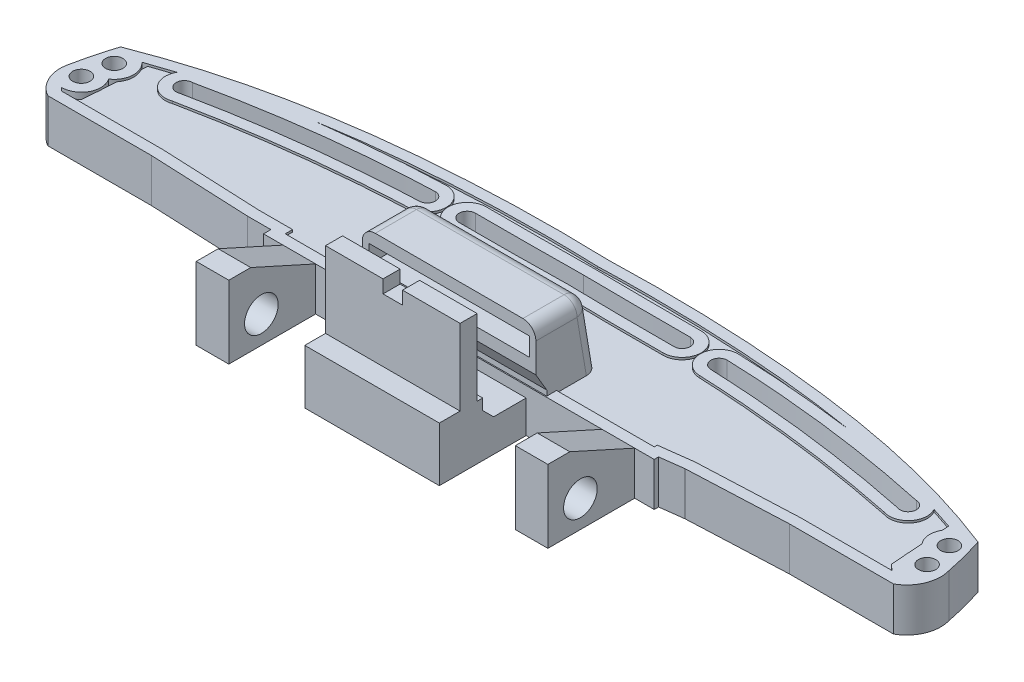
from build123d import *

# Parameters (mm, degrees)
SKETCH_1_R          = 0.8
EXTRUDE_1_DEPTH     = 4
SHELL_START         = 1
SHELL_1_DEPTH       = 3
EXTRUDE_2_DEPTH     = 3.8
EXTRUDE_3_DEPTH     = 6.7
CUT_EXTRUDE_1_REACH = 61.527
SKETCH_2_R          = 1.55
SKETCH_1_8_W        = 12.4
SKETCH_1_8_H        = 4
EXTRUDE_4_DEPTH     = 5
SKETCH_1_9_W        = 12.4
SKETCH_1_9_H        = 4
EXTRUDE_5_DEPTH     = 3
SKETCH_4_W          = 1.753819933
SKETCH_4_H          = 3
CUT_EXTRUDE_2_DEPTH = 8
EXTRUDE_6_DEPTH     = 8
CHAMFER_2_SIZE      = 1
SKETCH_1_11_R       = 0.8
EXTRUDE_7_DEPTH     = 4
FILLET_1_R          = 1
SKETCH_11_W         = 12.4
SKETCH_11_H         = 1.569277624
EXTRUDE_9_DEPTH     = 7
EXTRUDE_11_DEPTH    = 2
EXTRUDE_14_REACH    = 45.714
FILLET_2_R          = 1.2
SKETCH_15_W         = 14.8
SKETCH_15_H         = 1.7
EXTRUDE_15_DEPTH    = 1
EXTRUDE_16_DEPTH    = 16
SKETCH_18_W         = 1.797299214
SKETCH_18_H         = 2.4
CUT_EXTRUDE_3_DEPTH = 10


# Read off the part's stored shape, not the designer's step: 抽壳1
with BuildPart() as part:
    # 草图1 → 凸台-拉伸1 (new body)
    # profile 1 of 3: a face of its own
    with BuildSketch(Plane(origin=(0, 0, 0), x_dir=(1, 0, 0), z_dir=(0, 1, 0))):
        with BuildLine():
            Line((-38.96480314, -7.497712444), (-29.393525536, -7.497712444))
            Line((-29.393525536, -7.497712444), (-20.156837739, -7.907195239))
            Line((-20.156837739, -7.907195239), (-18, -7.907195239))
            Line((-18, -7.907195239), (-18, -8.583774419))
            Line((-18, -8.583774419), (-16.2, -8.583774419))
            Line((-16.2, -8.583774419), (-13.2, -8.583774419))
            Line((-13.2, -8.583774419), (-6.2, -8.583774419))
            Line((-6.2, -8.583774419), (6.2, -8.583774419))
            Line((6.2, -8.583774419), (13.2, -8.583774419))
            Line((13.2, -8.583774419), (16.2, -8.583774419))
            Line((16.2, -8.583774419), (18, -8.583774419))
            Line((18, -8.583774419), (18, -8.184966001))
            Line((18, -8.184966001), (20.156837739, -7.907195239))
            Line((20.156837739, -7.907195239), (29.393525536, -7.497712444))
            Line((29.393525536, -7.497712444), (38.96480314, -7.497712444))
            Line((38.96480314, -7.497712444), (37.300502483, -6.034961991))
            Line((37.300502483, -6.034961991), (36.881910732, -0.253586766))
            ThreePointArc((36.881910732, -0.253586766), (36.960080712, 0.200241061), (37.127970419, 0.629057209))
            add(Edge.make_bspline(
                [(37.127970419, 0.629057209), (30.270446567, 3.021780895), (17.796753113, 5.157311237), (5.274918027, 5.3743435), (0, 5.207531858)],
                knots=[0.063130869, 0.063130869, 0.063130869, 0.063130869, 0.605883571, 1, 1, 1, 1], degree=3))
            add(Edge.make_bspline(
                [(-37.127970419, 0.629057209), (-30.270446567, 3.021780895), (-17.796753113, 5.157311237), (-5.274918027, 5.3743435), (0, 5.207531858)],
                knots=[0.063130869, 0.063130869, 0.063130869, 0.063130869, 0.605883571, 1, 1, 1, 1], degree=3))
            ThreePointArc((-37.127970419, 0.629057209), (-36.960080712, 0.200241061), (-36.881910732, -0.253586766))
            Line((-36.881910732, -0.253586766), (-37.300502483, -6.034961991))
            Line((-37.300502483, -6.034961991), (-38.96480314, -7.497712444))
        make_face()
        with BuildLine():
            ThreePointArc((-33.061660008, -1.226254047), (-34.086546844, -0.682084578), (-33.351229287, 0.215591046))
            add(Edge.make_bspline(
                [(-33.351229287, 0.215591046), (-23.514023654, 2.352155328), (-13.434430896, 2.701648191)],
                knots=[0, 0, 0, 0.998944651, 0.998944651, 0.998944651], degree=2))
            ThreePointArc((-13.434430896, 2.701648191), (-12.694803379, 1.962371896), (-13.413133172, 1.20238465))
            add(Edge.make_bspline(
                [(-33.061660008, -1.226254047), (-23.344686362, 0.787158383), (-13.413133172, 1.20238465)],
                knots=[0, 0, 0, 1, 1, 1], degree=2))
        make_face(mode=Mode.SUBTRACT)
        with BuildLine():
            ThreePointArc((-9.887768141, 1.328554628), (-10.637768141, 2.078554628), (-9.887768141, 2.828554628))
            add(Edge.make_bspline(
                [(-9.887768141, 2.828554628), (-4.938004407, 2.816621436), (0.01152505, 2.875884827)],
                knots=[0, 0, 0, 1, 1, 1], degree=2))
            add(Edge.make_bspline(
                [(9.910818241, 2.828554628), (4.961054507, 2.816621436), (0.01152505, 2.875884827)],
                knots=[0, 0, 0, 1, 1, 1], degree=2))
            ThreePointArc((9.910818241, 2.828554628), (10.660818241, 2.078554628), (9.910818241, 1.328554628))
            add(Edge.make_bspline(
                [(9.910818241, 1.328554628), (4.96080606, 1.306493196), (0.01152505, 1.409786988)],
                knots=[0, 0, 0, 1, 1, 1], degree=2))
            add(Edge.make_bspline(
                [(-9.887768141, 1.328554628), (-4.93775596, 1.306493196), (0.01152505, 1.409786988)],
                knots=[0, 0, 0, 1, 1, 1], degree=2))
        make_face(mode=Mode.SUBTRACT)
        with BuildLine():
            add(Edge.make_bspline(
                [(33.061660008, -1.226254047), (23.344686362, 0.787158383), (13.413133172, 1.20238465)],
                knots=[0, 0, 0, 1, 1, 1], degree=2))
            ThreePointArc((13.413133172, 1.20238465), (12.694803379, 1.962371896), (13.434430896, 2.701648191))
            add(Edge.make_bspline(
                [(33.351229287, 0.215591046), (23.514023654, 2.352155328), (13.434430896, 2.701648191)],
                knots=[0, 0, 0, 0.998944651, 0.998944651, 0.998944651], degree=2))
            ThreePointArc((33.351229287, 0.215591046), (34.086546844, -0.682084578), (33.061660008, -1.226254047))
        make_face(mode=Mode.SUBTRACT)
    # profile 2 of 3: a face of its own
    with BuildSketch(Plane(origin=(0, 0, 0), x_dir=(1, 0, 0), z_dir=(0, 1, 0))):
        with BuildLine():
            ThreePointArc((-40.451237786, -3.867865455), (-40.341747598, -5.94230236), (-38.96480314, -7.497712444))
            Line((-38.96480314, -7.497712444), (-37.300502483, -6.034961991))
            Line((-37.300502483, -6.034961991), (-36.881910732, -0.253586766))
            ThreePointArc((-36.881910732, -0.253586766), (-36.960080712, 0.200241061), (-37.127970419, 0.629057209))
            add(Edge.make_bspline(
                [(-39.505366958, -0.253586766), (-38.718261239, 0.056798706), (-37.925610736, 0.350744961), (-37.127970419, 0.629057209)],
                knots=[0, 0, 0, 0, 0.063130869, 0.063130869, 0.063130869, 0.063130869], degree=3))
            ThreePointArc((-39.505366958, -0.253586766), (-40.028164459, -2.047677008), (-40.451237786, -3.867865455))
        make_face()
        with Locations(Location((-38.96480314, -4.404121314, 0), (0, 0, 270))):
            Circle(SKETCH_1_R, mode=Mode.SUBTRACT)
        with Locations(Location((-38.479248946, -1.862182302, 0), (0, 0, 270))):
            Circle(SKETCH_1_R, mode=Mode.SUBTRACT)
    # profile 3 of 3: a face of its own
    with BuildSketch(Plane(origin=(0, 0, 0), x_dir=(1, 0, 0), z_dir=(0, 1, 0))):
        with BuildLine():
            add(Edge.make_bspline(
                [(39.505366958, -0.253586766), (38.718261239, 0.056798706), (37.925610736, 0.350744961), (37.127970419, 0.629057209)],
                knots=[0, 0, 0, 0, 0.063130869, 0.063130869, 0.063130869, 0.063130869], degree=3))
            ThreePointArc((37.127970419, 0.629057209), (36.960080712, 0.200241061), (36.881910732, -0.253586766))
            Line((36.881910732, -0.253586766), (37.300502483, -6.034961991))
            Line((37.300502483, -6.034961991), (38.96480314, -7.497712444))
            ThreePointArc((38.96480314, -7.497712444), (40.341747598, -5.94230236), (40.451237786, -3.867865455))
            ThreePointArc((40.451237786, -3.867865455), (40.028164459, -2.047677008), (39.505366958, -0.253586766))
        make_face()
        with Locations(Location((38.96480314, -4.404121314, 0), (0, 0, 270))):
            Circle(SKETCH_1_R, mode=Mode.SUBTRACT)
        with Locations(Location((38.479248946, -1.862182302, 0), (0, 0, 270))):
            Circle(SKETCH_1_R, mode=Mode.SUBTRACT)
    extrude(amount=EXTRUDE_1_DEPTH)

    # 抽壳1 outline → 抽壳1 (cut)
    with BuildSketch(Plane(origin=(0, 0, 0), x_dir=(1, 0, 0), z_dir=(0, 1, 0)).offset(SHELL_START)):
        with BuildLine():
            add(Edge.make_bspline(
                [(-24.49070999, 2.779879065), (-24.059101821, 2.852450392), (-23.626992114, 2.922741536), (-23.194404558, 2.990785688), (-22.761362874, 3.056616067), (-22.327890816, 3.120265913), (-21.894012163, 3.181768496), (-21.459750721, 3.241157111), (-21.025130316, 3.298465077), (-20.590174791, 3.353725741), (-20.154908007, 3.406972473), (-19.49234821, 3.484957996), (-19.265264519, 3.511139327), (-19.038106147, 3.5367874), (-18.810876479, 3.561906949), (-18.5835789, 3.586502713), (-18.356216795, 3.610579427), (-18.128793551, 3.63414183), (-17.901312551, 3.657194657), (-17.673777182, 3.679742646), (-17.446190829, 3.701790533), (-16.990922924, 3.744895577), (-16.76323695, 3.765953394), (-16.535535964, 3.786516726), (-16.307709362, 3.806603903), (-16.079975464, 3.826198645), (-15.852126823, 3.845318548), (-15.624182283, 3.86397736), (-15.3963646, 3.88216395), (-15.168440109, 3.89988033), (-14.940524265, 3.917133229), (-14.256711016, 3.967500107), (-13.800762072, 3.999223967), (-13.344739701, 4.029109633), (-12.88864392, 4.057172967), (-12.432474744, 4.083429833), (-11.976232192, 4.107896096), (-11.519916278, 4.130587618), (-11.06352702, 4.151520264), (-10.607064435, 4.170709896), (-10.150528539, 4.188172379), (-9.237310159, 4.219674773), (-8.780627682, 4.233714674), (-8.323872017, 4.246059151), (-7.867043262, 4.256724074), (-7.410141515, 4.265725315), (-6.953166875, 4.273078745), (-6.49611944, 4.278800234), (-6.038999307, 4.282905654), (-5.581806577, 4.285410875), (-5.124541347, 4.286331769), (-4.438534898, 4.285360425), (-4.209847992, 4.284644532), (-3.981143016, 4.283538512), (-3.752419987, 4.282044352), (-3.523678926, 4.280164036), (-3.29491985, 4.277899551), (-3.066142779, 4.275252883), (-2.837347732, 4.272226016), (-2.608534727, 4.268820938), (-2.379703784, 4.265039633), (-2.036430489, 4.258806314), (-1.922001578, 4.256634981), (-1.807568191, 4.254370336), (-1.693130329, 4.252012628), (-1.578687996, 4.249562105), (-1.464241195, 4.247019016), (-1.349789928, 4.244383608), (-1.235334198, 4.241656131), (-1.120874008, 4.238836832), (-1.00640936, 4.23592596), (-0.834705706, 4.231422665), (-0.777470041, 4.229898735), (-0.720233262, 4.228352005), (-0.662995371, 4.226782507), (-0.605756367, 4.22519027), (-0.548516251, 4.223575326), (-0.491275022, 4.221937707), (-0.434032683, 4.220277442), (-0.376789232, 4.218594564), (-0.319544671, 4.216889103), (-0.247987581, 4.214729087), (-0.233676093, 4.214295675), (-0.219364536, 4.213860853), (-0.20505291, 4.213424623), (-0.190741215, 4.212986985), (-0.17642945, 4.212547939), (-0.162117615, 4.212107486), (-0.147805712, 4.211665627), (-0.133493739, 4.211222362), (-0.119181696, 4.210777691), (-0.101291556, 4.210220096), (-0.097713524, 4.210108489), (-0.094135488, 4.209996794), (-0.090557447, 4.209885012), (-0.086979401, 4.209773141), (-0.083401352, 4.209661183), (-0.079823298, 4.209549138), (-0.076245239, 4.209437004), (-0.072667177, 4.209324783), (-0.06908911, 4.209212473), (-0.063722003, 4.209043878), (-0.061932966, 4.208987658), (-0.060143928, 4.208931415), (-0.05835489, 4.208875151), (-0.05656585, 4.208818865), (-0.054776809, 4.208762557), (-0.052987766, 4.208706227), (-0.051198723, 4.208649875), (-0.049409679, 4.208593501), (-0.047620634, 4.208537105), (-0.044937064, 4.208452478), (-0.04404254, 4.208424264), (-0.043148017, 4.208396044), (-0.042253492, 4.208367819), (-0.041358968, 4.208339588), (-0.040464444, 4.208311352), (-0.039569919, 4.20828311), (-0.038675394, 4.208254863), (-0.037780868, 4.20822661), (-0.036886342, 4.208198352), (-0.035097291, 4.208141824), (-0.034196153, 4.208113347), (-0.033347957, 4.208086533), (-0.032301441, 4.20805345), (-0.031697693, 4.208034384), (-0.030471916, 4.207995538), (-0.029791451, 4.207974107), (-0.028796713, 4.207942598), (-0.027921431, 4.207914936), (-0.027018233, 4.207886371), (-0.023743776, 4.207782821), (-0.021369398, 4.207707735), (-0.018995021, 4.207632649), (-0.016620643, 4.207557562), (-0.014246265, 4.207482476), (-0.011871888, 4.20740739), (-0.00949751, 4.207332304), (-0.007123133, 4.207257217), (-0.004748755, 4.207182131), (-0.002374378, 4.207107045), (0, 4.207031959)],
                knots=[0.383882485, 0.383882485, 0.383882485, 0.383882485, 0.383882485, 0.383882485, 0.383882485, 0.383882485, 0.383882485, 0.383882485, 0.383882485, 0.383882485, 0.505, 0.505, 0.505, 0.505, 0.505, 0.505, 0.505, 0.505, 0.505, 0.505, 0.568125, 0.568125, 0.568125, 0.568125, 0.568125, 0.568125, 0.568125, 0.568125, 0.568125, 0.568125, 0.63125, 0.63125, 0.63125, 0.63125, 0.63125, 0.63125, 0.63125, 0.63125, 0.63125, 0.63125, 0.7575, 0.7575, 0.7575, 0.7575, 0.7575, 0.7575, 0.7575, 0.7575, 0.7575, 0.7575, 0.88375, 0.88375, 0.88375, 0.88375, 0.88375, 0.88375, 0.88375, 0.88375, 0.88375, 0.88375, 0.946875, 0.946875, 0.946875, 0.946875, 0.946875, 0.946875, 0.946875, 0.946875, 0.946875, 0.946875, 0.9784375, 0.9784375, 0.9784375, 0.9784375, 0.9784375, 0.9784375, 0.9784375, 0.9784375, 0.9784375, 0.9784375, 0.99421875, 0.99421875, 0.99421875, 0.99421875, 0.99421875, 0.99421875, 0.99421875, 0.99421875, 0.99421875, 0.99421875, 0.998164063, 0.998164063, 0.998164063, 0.998164063, 0.998164063, 0.998164063, 0.998164063, 0.998164063, 0.998164063, 0.998164063, 0.999150391, 0.999150391, 0.999150391, 0.999150391, 0.999150391, 0.999150391, 0.999150391, 0.999150391, 0.999150391, 0.999150391, 0.999643555, 0.999643555, 0.999643555, 0.999643555, 0.999643555, 0.999643555, 0.999643555, 0.999643555, 0.999643555, 0.999643555, 0.999890137, 0.999890137, 0.999890137, 0.999890137, 0.999890137, 0.999890137, 0.999890137, 0.999890137, 0.999890137, 0.999890137, 1.000136719, 1.000136719, 1.000136719, 1.000136719, 1.000136719, 1.000136719, 1.000136719, 1.000136719, 1.000136719, 1.000136719, 1.000787193, 1.000787193, 1.000787193, 1.000787193, 1.000787193, 1.000787193, 1.000787193, 1.000787193, 1.000787193, 1.000787193, 1.000787193, 1.000787193], degree=11))
            add(Edge.make_bspline(
                [(-24.49070999, 2.779879065), (-21.748635709, 3.144934355), (-18.99439778, 3.42026236), (-16.228112074, 3.605848196), (-13.449897442, 3.701711241)],
                knots=[0.454040233, 0.454040233, 0.454040233, 0.454040233, 0.454040233, 0.999887046, 0.999887046, 0.999887046, 0.999887046, 0.999887046], degree=4))
            ThreePointArc((-13.449897442, 3.701711241), (-11.695168511, 1.990994624), (-13.371360869, 0.203257467))
            add(Edge.make_bspline(
                [(-32.784419443, -2.190073956), (-27.983794129, -1.198486701), (-23.14842313, -0.469147382), (-18.277790862, -0.00187443), (-13.371360869, 0.203257467)],
                knots=[0.003856844, 0.003856844, 0.003856844, 0.003856844, 0.003856844, 1, 1, 1, 1, 1], degree=4))
            ThreePointArc((-32.784419443, -2.190073956), (-34.695719439, -1.654608146), (-34.877383315, 0.321951882))
            add(Edge.make_bspline(
                [(-37.308058106, -0.495320229), (-37.088579358, -0.41665047), (-36.868791932, -0.338870399), (-36.648699263, -0.261974934), (-36.428304789, -0.185958999), (-36.207611957, -0.110817516), (-35.986624221, -0.036545414), (-35.765345042, 0.036862381), (-35.543777887, 0.109410941), (-35.321926231, 0.181105334), (-35.099793553, 0.25195063), (-34.877383315, 0.321951882)],
                knots=[0.049459177, 0.049459177, 0.049459177, 0.049459177, 0.049459177, 0.049459177, 0.049459177, 0.049459177, 0.049459177, 0.049459177, 0.049459177, 0.049459177, 0.114334132, 0.114334132, 0.114334132, 0.114334132, 0.114334132, 0.114334132, 0.114334132, 0.114334132, 0.114334132, 0.114334132, 0.114334132, 0.114334132], degree=11))
            ThreePointArc((-37.308058106, -0.495320229), (-36.682966651, -1.977810666), (-37.492970133, -3.367922685))
            ThreePointArc((-37.492970133, -3.367922685), (-37.377575586, -5.25306695), (-39.009642545, -6.203562736))
            ThreePointArc((-39.009642545, -6.203562736), (-38.850983217, -6.359241138), (-38.677103244, -6.497712444))
            Line((-38.677103244, -6.497712444), (-29.37137031, -6.497712444))
            Line((-29.37137031, -6.497712444), (-20.134682514, -6.907195239))
            Line((-20.134682514, -6.907195239), (-17, -6.907195239))
            Line((-17, -6.907195239), (-17, -7.583774419))
            Line((-17, -7.583774419), (17, -7.583774419))
            Line((17, -7.583774419), (17, -7.305493292))
            Line((17, -7.305493292), (20.070676682, -6.910032759))
            Line((20.070676682, -6.910032759), (29.37137031, -6.497712444))
            Line((29.37137031, -6.497712444), (38.677103244, -6.497712444))
            ThreePointArc((38.677103244, -6.497712444), (38.850983217, -6.359241138), (39.009642545, -6.203562736))
            ThreePointArc((39.009642545, -6.203562736), (37.377575586, -5.25306695), (37.492970133, -3.367922685))
            ThreePointArc((37.492970133, -3.367922685), (36.682966651, -1.977810666), (37.308058039, -0.495320254))
            add(Edge.make_bspline(
                [(37.308058039, -0.495320254), (37.088579358, -0.41665047), (36.868791932, -0.338870399), (36.648699263, -0.261974934), (36.428304789, -0.185958999), (36.207611957, -0.110817516), (35.986624221, -0.036545414), (35.765345042, 0.036862381), (35.543777887, 0.109410941), (35.321926231, 0.181105334), (35.099793553, 0.25195063), (34.877383341, 0.321951897)],
                knots=[0.049459177, 0.049459177, 0.049459177, 0.049459177, 0.049459177, 0.049459177, 0.049459177, 0.049459177, 0.049459177, 0.049459177, 0.049459177, 0.049459177, 0.114334132, 0.114334132, 0.114334132, 0.114334132, 0.114334132, 0.114334132, 0.114334132, 0.114334132, 0.114334132, 0.114334132, 0.114334132, 0.114334132], degree=11))
            ThreePointArc((34.877383341, 0.321951897), (34.695719439, -1.654608146), (32.784419443, -2.190073956))
            add(Edge.make_bspline(
                [(32.784419443, -2.190073956), (31.711034882, -1.96836233), (30.63618455, -1.757712874), (29.559865413, -1.558124499), (28.482074403, -1.369596245), (27.402808411, -1.192127273), (26.322064295, -1.025716877), (25.239838874, -0.870364472), (24.156128933, -0.726069603), (22.52415647, -0.525700405), (21.977004036, -0.461375854), (21.429473503, -0.399858274), (20.88156446, -0.341147647), (20.333276493, -0.285243959), (19.78460919, -0.232147194), (19.235562139, -0.181857337), (18.686134926, -0.134374371), (17.861423249, -0.067360236), (17.586424213, -0.045723916), (17.311329982, -0.024789323), (17.036140507, -0.00455646), (16.760855734, 0.01497467), (16.485475614, 0.033804063), (16.210000095, 0.051931719), (15.934429127, 0.069357632), (15.520929423, 0.094443886), (15.383072313, 0.102630535), (15.245191321, 0.110641746), (15.107286442, 0.118477519), (14.969357668, 0.126137855), (14.831404994, 0.133622751), (14.693428414, 0.140932207), (14.55542792, 0.148066224), (14.3483913, 0.158504087), (14.279373114, 0.161939514), (14.210348946, 0.165331081), (14.141318798, 0.168678788), (14.072282667, 0.171982634), (14.003240553, 0.175242619), (13.934192456, 0.178458744), (13.865138374, 0.181631008), (13.761548273, 0.186323612), (13.727016742, 0.187876849), (13.692483716, 0.18941912), (13.657949193, 0.190950425), (13.623413173, 0.192470766), (13.588875657, 0.193980141), (13.554336644, 0.195478551), (13.519796133, 0.196965995), (13.476618625, 0.198811594), (13.467983029, 0.199180029), (13.45934734, 0.199547778), (13.450711558, 0.199914842), (13.442075682, 0.20028122), (13.433439712, 0.200646913), (13.424803649, 0.201011921), (13.416167492, 0.201376243), (13.405372179, 0.20183079), (13.403213111, 0.201921656), (13.401054036, 0.20201248), (13.398894956, 0.202103261), (13.39673587, 0.202193999), (13.394576779, 0.202284694), (13.392417681, 0.202375346), (13.390258577, 0.202465956), (13.387019913, 0.202601805), (13.385940357, 0.202647078), (13.384860799, 0.20269234), (13.38378124, 0.202737591), (13.38270168, 0.202782832), (13.381622118, 0.202828061), (13.380542554, 0.20287328), (13.379462989, 0.202918489), (13.37784364, 0.202986285), (13.377303856, 0.203008881), (13.376764072, 0.203031475), (13.376224288, 0.203054066), (13.375684503, 0.203076654), (13.375144718, 0.203099239), (13.374604933, 0.203121822), (13.374065147, 0.203144402), (13.373245875, 0.203178669), (13.372967645, 0.203190306), (13.3726858, 0.203202093), (13.372406375, 0.203213779), (13.372128284, 0.203225407), (13.3718496, 0.20323706), (13.371569678, 0.203248763), (13.371288739, 0.203260509), (13.37100722, 0.203272279)],
                knots=[0.003856844, 0.003856844, 0.003856844, 0.003856844, 0.003856844, 0.003856844, 0.003856844, 0.003856844, 0.003856844, 0.003856844, 0.505, 0.505, 0.505, 0.505, 0.505, 0.505, 0.505, 0.505, 0.7575, 0.7575, 0.7575, 0.7575, 0.7575, 0.7575, 0.7575, 0.7575, 0.88375, 0.88375, 0.88375, 0.88375, 0.88375, 0.88375, 0.88375, 0.88375, 0.946875, 0.946875, 0.946875, 0.946875, 0.946875, 0.946875, 0.946875, 0.946875, 0.9784375, 0.9784375, 0.9784375, 0.9784375, 0.9784375, 0.9784375, 0.9784375, 0.9784375, 0.99421875, 0.99421875, 0.99421875, 0.99421875, 0.99421875, 0.99421875, 0.99421875, 0.99421875, 0.998164063, 0.998164063, 0.998164063, 0.998164063, 0.998164063, 0.998164063, 0.998164063, 0.998164063, 0.999150391, 0.999150391, 0.999150391, 0.999150391, 0.999150391, 0.999150391, 0.999150391, 0.999150391, 0.999643555, 0.999643555, 0.999643555, 0.999643555, 0.999643555, 0.999643555, 0.999643555, 0.999643555, 0.999890137, 0.999890137, 0.999890137, 0.999890137, 0.999890137, 0.999890137, 0.999890137, 0.999890137, 1.00001781, 1.00001781, 1.00001781, 1.00001781, 1.00001781, 1.00001781, 1.00001781, 1.00001781, 1.00001781, 1.00001781], degree=9))
            ThreePointArc((13.37100722, 0.203272279), (11.695172493, 1.991171614), (13.449897442, 3.701711241))
            add(Edge.make_bspline(
                [(24.490709812, 2.779879074), (21.748635709, 3.144934355), (18.99439778, 3.42026236), (16.228112074, 3.605848196), (13.449897442, 3.701711241)],
                knots=[0.454040233, 0.454040233, 0.454040233, 0.454040233, 0.454040233, 0.999887046, 0.999887046, 0.999887046, 0.999887046, 0.999887046], degree=4))
            add(Edge.make_bspline(
                [(24.490709812, 2.779879074), (24.059101821, 2.852450392), (23.626992114, 2.922741536), (23.194404558, 2.990785688), (22.761362874, 3.056616067), (22.327890816, 3.120265913), (21.894012163, 3.181768496), (21.459750721, 3.241157111), (21.025130316, 3.298465077), (20.590174791, 3.353725741), (20.154908007, 3.406972473), (19.49234821, 3.484957996), (19.265264519, 3.511139327), (19.038106147, 3.5367874), (18.810876479, 3.561906949), (18.5835789, 3.586502713), (18.356216795, 3.610579427), (18.128793551, 3.63414183), (17.901312551, 3.657194657), (17.673777182, 3.679742646), (17.446190829, 3.701790533), (16.990922924, 3.744895577), (16.76323695, 3.765953394), (16.535535964, 3.786516726), (16.307709362, 3.806603903), (16.079975464, 3.826198645), (15.852126823, 3.845318548), (15.624182283, 3.86397736), (15.3963646, 3.88216395), (15.168440109, 3.89988033), (14.940524265, 3.917133229), (14.256711016, 3.967500107), (13.800762072, 3.999223967), (13.344739701, 4.029109633), (12.88864392, 4.057172967), (12.432474744, 4.083429833), (11.976232192, 4.107896096), (11.519916278, 4.130587618), (11.06352702, 4.151520264), (10.607064435, 4.170709896), (10.150528539, 4.188172379), (9.237310159, 4.219674773), (8.780627682, 4.233714674), (8.323872017, 4.246059151), (7.867043262, 4.256724074), (7.410141515, 4.265725315), (6.953166875, 4.273078745), (6.49611944, 4.278800234), (6.038999307, 4.282905654), (5.581806577, 4.285410875), (5.124541347, 4.286331769), (4.438534898, 4.285360425), (4.209847992, 4.284644532), (3.981143016, 4.283538512), (3.752419987, 4.282044352), (3.523678926, 4.280164036), (3.29491985, 4.277899551), (3.066142779, 4.275252883), (2.837347732, 4.272226016), (2.608534727, 4.268820938), (2.379703784, 4.265039633), (2.036430489, 4.258806314), (1.922001578, 4.256634981), (1.807568191, 4.254370336), (1.693130329, 4.252012628), (1.578687996, 4.249562105), (1.464241195, 4.247019016), (1.349789928, 4.244383608), (1.235334198, 4.241656131), (1.120874008, 4.238836832), (1.00640936, 4.23592596), (0.834705706, 4.231422665), (0.777470041, 4.229898735), (0.720233262, 4.228352005), (0.662995371, 4.226782507), (0.605756367, 4.22519027), (0.548516251, 4.223575326), (0.491275022, 4.221937707), (0.434032683, 4.220277442), (0.376789232, 4.218594564), (0.319544671, 4.216889103), (0.247987581, 4.214729087), (0.233676093, 4.214295675), (0.219364536, 4.213860853), (0.20505291, 4.213424623), (0.190741215, 4.212986985), (0.17642945, 4.212547939), (0.162117615, 4.212107486), (0.147805712, 4.211665627), (0.133493739, 4.211222362), (0.119181696, 4.210777691), (0.101291556, 4.210220096), (0.097713524, 4.210108489), (0.094135488, 4.209996794), (0.090557447, 4.209885012), (0.086979401, 4.209773141), (0.083401352, 4.209661183), (0.079823298, 4.209549138), (0.076245239, 4.209437004), (0.072667177, 4.209324783), (0.06908911, 4.209212473), (0.063722003, 4.209043878), (0.061932966, 4.208987658), (0.060143928, 4.208931415), (0.05835489, 4.208875151), (0.05656585, 4.208818865), (0.054776809, 4.208762557), (0.052987766, 4.208706227), (0.051198723, 4.208649875), (0.049409679, 4.208593501), (0.047620634, 4.208537105), (0.044937064, 4.208452478), (0.04404254, 4.208424264), (0.043148017, 4.208396044), (0.042253492, 4.208367819), (0.041358968, 4.208339588), (0.040464444, 4.208311352), (0.039569919, 4.20828311), (0.038675394, 4.208254863), (0.037780868, 4.20822661), (0.036886342, 4.208198352), (0.035097291, 4.208141824), (0.034196153, 4.208113347), (0.033347957, 4.208086533), (0.032301441, 4.20805345), (0.031697693, 4.208034384), (0.030471916, 4.207995538), (0.029791451, 4.207974107), (0.028796713, 4.207942598), (0.027921431, 4.207914936), (0.027018233, 4.207886371), (0.023743776, 4.207782821), (0.021369398, 4.207707735), (0.018995021, 4.207632649), (0.016620643, 4.207557562), (0.014246265, 4.207482476), (0.011871888, 4.20740739), (0.00949751, 4.207332304), (0.007123133, 4.207257217), (0.004748755, 4.207182131), (0.002374378, 4.207107045), (0, 4.207031959)],
                knots=[0.383882485, 0.383882485, 0.383882485, 0.383882485, 0.383882485, 0.383882485, 0.383882485, 0.383882485, 0.383882485, 0.383882485, 0.383882485, 0.383882485, 0.505, 0.505, 0.505, 0.505, 0.505, 0.505, 0.505, 0.505, 0.505, 0.505, 0.568125, 0.568125, 0.568125, 0.568125, 0.568125, 0.568125, 0.568125, 0.568125, 0.568125, 0.568125, 0.63125, 0.63125, 0.63125, 0.63125, 0.63125, 0.63125, 0.63125, 0.63125, 0.63125, 0.63125, 0.7575, 0.7575, 0.7575, 0.7575, 0.7575, 0.7575, 0.7575, 0.7575, 0.7575, 0.7575, 0.88375, 0.88375, 0.88375, 0.88375, 0.88375, 0.88375, 0.88375, 0.88375, 0.88375, 0.88375, 0.946875, 0.946875, 0.946875, 0.946875, 0.946875, 0.946875, 0.946875, 0.946875, 0.946875, 0.946875, 0.9784375, 0.9784375, 0.9784375, 0.9784375, 0.9784375, 0.9784375, 0.9784375, 0.9784375, 0.9784375, 0.9784375, 0.99421875, 0.99421875, 0.99421875, 0.99421875, 0.99421875, 0.99421875, 0.99421875, 0.99421875, 0.99421875, 0.99421875, 0.998164063, 0.998164063, 0.998164063, 0.998164063, 0.998164063, 0.998164063, 0.998164063, 0.998164063, 0.998164063, 0.998164063, 0.999150391, 0.999150391, 0.999150391, 0.999150391, 0.999150391, 0.999150391, 0.999150391, 0.999150391, 0.999150391, 0.999150391, 0.999643555, 0.999643555, 0.999643555, 0.999643555, 0.999643555, 0.999643555, 0.999643555, 0.999643555, 0.999643555, 0.999643555, 0.999890137, 0.999890137, 0.999890137, 0.999890137, 0.999890137, 0.999890137, 0.999890137, 0.999890137, 0.999890137, 0.999890137, 1.000136719, 1.000136719, 1.000136719, 1.000136719, 1.000136719, 1.000136719, 1.000136719, 1.000136719, 1.000136719, 1.000136719, 1.000787193, 1.000787193, 1.000787193, 1.000787193, 1.000787193, 1.000787193, 1.000787193, 1.000787193, 1.000787193, 1.000787193, 1.000787193, 1.000787193], degree=11))
        make_face()
        with BuildLine():
            add(Edge.make_bspline(
                [(-9.887768185, 0.328544722), (-6.587761265, 0.31387463), (-3.287994167, 0.340883018), (0.01152505, 0.409569779)],
                knots=[0.000449028, 0.000449028, 0.000449028, 0.000449028, 0.997897403, 0.997897403, 0.997897403, 0.997897403], degree=3))
            ThreePointArc((-9.887768185, 0.328544722), (-11.637767726, 2.079760056), (-9.885357285, 3.828552967))
            add(Edge.make_bspline(
                [(-9.885357285, 3.828552967), (-9.501357467, 3.827625952), (-9.117358418, 3.826932624), (-8.733360139, 3.826471739), (-8.349362629, 3.826243297), (-7.965365888, 3.826247297), (-7.581369915, 3.826483741), (-7.19737471, 3.826952626), (-6.81338027, 3.827653955), (-6.429386597, 3.828587726), (-6.045393689, 3.82975394), (-5.661401546, 3.831152596), (-5.277410167, 3.832783695), (-4.701424243, 3.835579007), (-4.509429125, 3.836568889), (-4.317434199, 3.837616881), (-4.125439463, 3.838722984), (-3.933444918, 3.839887197), (-3.741450563, 3.841109521), (-3.549456399, 3.842389956), (-3.357462425, 3.843728502), (-3.165468641, 3.845125158), (-2.973475047, 3.846579925), (-2.781481644, 3.848092802), (-2.58948843, 3.84966379), (-2.301498895, 3.852107439), (-2.20550243, 3.852936516), (-2.109506013, 3.85378012), (-2.013509644, 3.854638253), (-1.917513322, 3.855510913), (-1.821517047, 3.856398101), (-1.72552082, 3.857299816), (-1.62952464, 3.858216059), (-1.533528508, 3.85914683), (-1.437532423, 3.860092129), (-1.341536385, 3.861051955), (-1.245540395, 3.862026308), (-1.101546481, 3.863509631), (-1.053548521, 3.864007703), (-1.005550574, 3.864509408), (-0.957552638, 3.865014744), (-0.909554714, 3.865523713), (-0.861556801, 3.866036313), (-0.813558901, 3.866552545), (-0.765561012, 3.86707241), (-0.717563136, 3.867595906), (-0.669565271, 3.868123034), (-0.621567418, 3.868653794), (-0.573569576, 3.869188185), (-0.501572832, 3.869995221), (-0.477573921, 3.870265141), (-0.453575012, 3.870535969), (-0.429576106, 3.870807704), (-0.405577203, 3.871080348), (-0.381578303, 3.8713539), (-0.357579406, 3.87162836), (-0.333580512, 3.871903728), (-0.309581621, 3.872180003), (-0.285582733, 3.872457187), (-0.261583848, 3.872735279), (-0.237584966, 3.873014278), (-0.201586647, 3.87343414), (-0.189587208, 3.873574321), (-0.17758777, 3.873714728), (-0.165588332, 3.873855363), (-0.153588896, 3.873996225), (-0.14158946, 3.874137314), (-0.129590024, 3.874278629), (-0.11759059, 3.874420172), (-0.105591156, 3.874561942), (-0.093591723, 3.874703939), (-0.081592291, 3.874846163), (-0.06959286, 3.874988613), (-0.054593571, 3.875166961), (-0.051593713, 3.875202644), (-0.048593856, 3.875238342), (-0.045593998, 3.875274054), (-0.042594141, 3.87530978), (-0.039594283, 3.875345521), (-0.036594426, 3.875381275), (-0.033594569, 3.875417044), (-0.030594711, 3.875452827), (-0.027594854, 3.875488624), (-0.024594997, 3.875524435), (-0.02159514, 3.875560261), (-0.016279672, 3.875623765), (-0.013968255, 3.875651389), (-0.01162883, 3.875679356), (-0.009372686, 3.87570632), (-0.006979084, 3.875735001), (-0.004709028, 3.875762093), (-0.002398368, 3.875789784), (-7.1166e-05, 3.875817666), (0.002250462, 3.875845461), (0.004568736, 3.875873216), (0.006887081, 3.875900974), (0.009205956, 3.87592874), (0.011525, 3.875956507)],
                knots=[0, 0, 0, 0, 0, 0, 0, 0, 0, 0, 0, 0, 0, 0, 0.505, 0.505, 0.505, 0.505, 0.505, 0.505, 0.505, 0.505, 0.505, 0.505, 0.505, 0.505, 0.7575, 0.7575, 0.7575, 0.7575, 0.7575, 0.7575, 0.7575, 0.7575, 0.7575, 0.7575, 0.7575, 0.7575, 0.88375, 0.88375, 0.88375, 0.88375, 0.88375, 0.88375, 0.88375, 0.88375, 0.88375, 0.88375, 0.88375, 0.88375, 0.946875, 0.946875, 0.946875, 0.946875, 0.946875, 0.946875, 0.946875, 0.946875, 0.946875, 0.946875, 0.946875, 0.946875, 0.9784375, 0.9784375, 0.9784375, 0.9784375, 0.9784375, 0.9784375, 0.9784375, 0.9784375, 0.9784375, 0.9784375, 0.9784375, 0.9784375, 0.99421875, 0.99421875, 0.99421875, 0.99421875, 0.99421875, 0.99421875, 0.99421875, 0.99421875, 0.99421875, 0.99421875, 0.99421875, 0.99421875, 0.998164063, 0.998164063, 0.998164063, 0.998164063, 0.998164063, 0.998164063, 0.998164063, 0.998164063, 0.998164063, 0.998164063, 0.998164063, 0.998164063, 1.001209477, 1.001209477, 1.001209477, 1.001209477, 1.001209477, 1.001209477, 1.001209477, 1.001209477, 1.001209477, 1.001209477, 1.001209477, 1.001209477, 1.001209477, 1.001209477], degree=13))
            add(Edge.make_bspline(
                [(9.910818229, 3.828557533), (9.906448922, 3.828546998), (9.902082943, 3.828536478), (9.897722282, 3.828525997), (9.893363769, 3.828515576), (9.888995018, 3.828505175), (9.884612911, 3.828494708), (9.880262598, 3.828484325), (9.875950216, 3.828474317), (9.871458762, 3.82846347), (9.867230691, 3.828453706), (9.862782456, 3.828443185), (9.858447784, 3.82843307), (9.854078665, 3.828422876), (9.838461179, 3.828386559), (9.827208006, 3.828360588), (9.815954833, 3.828334816), (9.804701661, 3.828309243), (9.79344849, 3.828283868), (9.782195319, 3.828258691), (9.770942149, 3.828233713), (9.759688979, 3.828208933), (9.748435811, 3.828184352), (9.737182643, 3.828159969), (9.725929475, 3.828135785), (9.714676309, 3.828111799), (9.703423143, 3.828088011), (9.669663646, 3.828017244), (9.647157318, 3.82797086), (9.624650992, 3.827925269), (9.602144669, 3.827880472), (9.579638349, 3.827836469), (9.557132031, 3.82779326), (9.534625716, 3.827750844), (9.512119404, 3.827709222), (9.489613094, 3.827668394), (9.467106787, 3.82762836), (9.444600482, 3.827589119), (9.42209418, 3.827550672), (9.399587881, 3.827513019), (9.332068991, 3.827402441), (9.287056408, 3.827331898), (9.242043835, 3.827264529), (9.197031274, 3.827200336), (9.152018722, 3.827139317), (9.107006182, 3.827081473), (9.061993651, 3.827026805), (9.016981132, 3.826975311), (8.971968622, 3.826926993), (8.926956123, 3.826881849), (8.881943635, 3.826839881), (8.836931157, 3.826801088), (8.79191869, 3.826765469), (8.65688132, 3.826668139), (8.566856448, 3.826615952), (8.476831619, 3.826576466), (8.386806831, 3.826549679), (8.296782086, 3.826535593), (8.206757382, 3.826534206), (8.116732721, 3.82654552), (8.026708101, 3.826569534), (7.936683524, 3.826606248), (7.846658988, 3.826655662), (7.756634494, 3.826717776), (7.666610042, 3.82679259), (7.576585632, 3.826880105), (7.306512528, 3.827180748), (7.12646396, 3.827431977), (6.946415559, 3.827734006), (6.766367326, 3.828086836), (6.58631926, 3.828490466), (6.406271361, 3.828944896), (6.22622363, 3.829450127), (6.046176066, 3.830006158), (5.86612867, 3.83061299), (5.68608144, 3.831270621), (5.506034377, 3.831979054), (5.325987482, 3.832738286), (5.145940753, 3.833548319), (4.785847629, 3.835269985), (4.605801234, 3.836181619), (4.425755006, 3.837144053), (4.245708944, 3.838157287), (4.065663049, 3.839221321), (3.88561732, 3.840336156), (3.705571759, 3.841501791), (3.525526363, 3.842718227), (3.345481134, 3.843985463), (3.165436071, 3.845303499), (2.985391174, 3.846672336), (2.805346444, 3.848091973), (2.625301879, 3.84956241), (2.355235282, 3.851844266), (2.265213124, 3.852617585), (2.175191008, 3.853403604), (2.085168933, 3.854202323), (1.9951469, 3.855013743), (1.905124908, 3.855837862), (1.815102958, 3.856674681), (1.725081049, 3.857524201), (1.635059181, 3.85838642), (1.545037355, 3.85926134), (1.455015571, 3.86014896), (1.364993828, 3.861049279), (1.274972126, 3.861962299), (1.139939636, 3.863350879), (1.094928816, 3.863816914), (1.049918006, 3.864286124), (1.004907207, 3.864758509), (0.959896419, 3.865234069), (0.91488564, 3.865712805), (0.869874872, 3.866194715), (0.824864114, 3.8666798), (0.779853367, 3.86716806), (0.73484263, 3.867659495), (0.689831903, 3.868154105), (0.644821187, 3.868651891), (0.599810481, 3.869152851), (0.532294437, 3.869909054), (0.509789092, 3.870161915), (0.487283749, 3.87041557), (0.464778409, 3.870670019), (0.442273072, 3.870925262), (0.419767737, 3.871181298), (0.397262405, 3.871438129), (0.374757075, 3.871695753), (0.352251748, 3.87195417), (0.329746423, 3.872213382), (0.307241101, 3.872473387), (0.284735782, 3.872734186), (0.262230465, 3.872995779), (0.228472493, 3.873389358), (0.217219837, 3.87352075), (0.205967181, 3.87365234), (0.194714526, 3.873784129), (0.183461871, 3.873916116), (0.172209218, 3.874048301), (0.160956564, 3.874180685), (0.149703912, 3.874313267), (0.13845126, 3.874446048), (0.127198608, 3.874579027), (0.115945958, 3.874712205), (0.104693308, 3.874845581), (0.093440658, 3.874979155), (0.077141897, 3.875172917), (0.072089359, 3.875233027), (0.067091071, 3.875292488), (0.061873014, 3.875354815), (0.05720903, 3.875409928), (0.051600709, 3.875477748), (0.047097951, 3.875530247), (0.041742965, 3.875595335), (0.036750805, 3.875654392), (0.031745191, 3.87571433), (0.026690631, 3.875774926), (0.021632428, 3.875835494), (0.016578114, 3.875896005), (0.011525, 3.875956507)],
                knots=[-0.000243532, -0.000243532, -0.000243532, -0.000243532, -0.000243532, -0.000243532, -0.000243532, -0.000243532, -0.000243532, -0.000243532, -0.000243532, -0.000243532, -0.000243532, -0.000243532, -0.000243532, 0.0059375, 0.0059375, 0.0059375, 0.0059375, 0.0059375, 0.0059375, 0.0059375, 0.0059375, 0.0059375, 0.0059375, 0.0059375, 0.0059375, 0.0059375, 0.021875, 0.021875, 0.021875, 0.021875, 0.021875, 0.021875, 0.021875, 0.021875, 0.021875, 0.021875, 0.021875, 0.021875, 0.021875, 0.05375, 0.05375, 0.05375, 0.05375, 0.05375, 0.05375, 0.05375, 0.05375, 0.05375, 0.05375, 0.05375, 0.05375, 0.05375, 0.1175, 0.1175, 0.1175, 0.1175, 0.1175, 0.1175, 0.1175, 0.1175, 0.1175, 0.1175, 0.1175, 0.1175, 0.1175, 0.245, 0.245, 0.245, 0.245, 0.245, 0.245, 0.245, 0.245, 0.245, 0.245, 0.245, 0.245, 0.245, 0.5, 0.5, 0.5, 0.5, 0.5, 0.5, 0.5, 0.5, 0.5, 0.5, 0.5, 0.5, 0.5, 0.755, 0.755, 0.755, 0.755, 0.755, 0.755, 0.755, 0.755, 0.755, 0.755, 0.755, 0.755, 0.755, 0.8825, 0.8825, 0.8825, 0.8825, 0.8825, 0.8825, 0.8825, 0.8825, 0.8825, 0.8825, 0.8825, 0.8825, 0.8825, 0.94625, 0.94625, 0.94625, 0.94625, 0.94625, 0.94625, 0.94625, 0.94625, 0.94625, 0.94625, 0.94625, 0.94625, 0.94625, 0.978125, 0.978125, 0.978125, 0.978125, 0.978125, 0.978125, 0.978125, 0.978125, 0.978125, 0.978125, 0.978125, 0.978125, 0.978125, 0.9940625, 0.9940625, 0.9940625, 0.9940625, 0.9940625, 0.9940625, 0.9940625, 0.9940625, 0.9940625, 0.9940625, 0.9940625, 0.9940625, 0.9940625, 1.001209477, 1.001209477, 1.001209477, 1.001209477, 1.001209477, 1.001209477, 1.001209477, 1.001209477, 1.001209477, 1.001209477, 1.001209477, 1.001209477, 1.001209477, 1.001209477, 1.001209477], degree=14))
            ThreePointArc((9.910818229, 3.828557533), (11.660816822, 2.080783035), (9.915275051, 0.328560303))
            add(Edge.make_bspline(
                [(9.915275051, 0.328560303), (6.613782319, 0.313850322), (3.312529633, 0.340852097), (0.01152505, 0.409569779)],
                knots=[0, 0, 0, 0, 0.997897403, 0.997897403, 0.997897403, 0.997897403], degree=3))
        make_face(mode=Mode.SUBTRACT)
    extrude(amount=SHELL_1_DEPTH, mode=Mode.SUBTRACT)

    # 草图1<3> → 凸台-拉伸2 (add)
    with BuildSketch(Plane(origin=(0, 0, 0), x_dir=(1, 0, 0), z_dir=(0, 1, 0))):
        with BuildLine():
            Line((-38.96480314, -7.497712444), (-29.393525536, -7.497712444))
            Line((-29.393525536, -7.497712444), (-20.156837739, -7.907195239))
            Line((-20.156837739, -7.907195239), (-18, -7.907195239))
            Line((-18, -7.907195239), (-18, -8.583774419))
            Line((-18, -8.583774419), (-16.2, -8.583774419))
            Line((-16.2, -8.583774419), (-13.2, -8.583774419))
            Line((-13.2, -8.583774419), (-6.2, -8.583774419))
            Line((-6.2, -8.583774419), (6.2, -8.583774419))
            Line((6.2, -8.583774419), (13.2, -8.583774419))
            Line((13.2, -8.583774419), (16.2, -8.583774419))
            Line((16.2, -8.583774419), (18, -8.583774419))
            Line((18, -8.583774419), (18, -8.184966001))
            Line((18, -8.184966001), (20.156837739, -7.907195239))
            Line((20.156837739, -7.907195239), (29.393525536, -7.497712444))
            Line((29.393525536, -7.497712444), (38.96480314, -7.497712444))
            Line((38.96480314, -7.497712444), (37.300502483, -6.034961991))
            Line((37.300502483, -6.034961991), (36.881910732, -0.253586766))
            ThreePointArc((36.881910732, -0.253586766), (36.960080712, 0.200241061), (37.127970419, 0.629057209))
            add(Edge.make_bspline(
                [(37.127970419, 0.629057209), (30.270446567, 3.021780895), (17.796753113, 5.157311237), (5.274918027, 5.3743435), (0, 5.207531858)],
                knots=[0.063130869, 0.063130869, 0.063130869, 0.063130869, 0.605883571, 1, 1, 1, 1], degree=3))
            add(Edge.make_bspline(
                [(-37.127970419, 0.629057209), (-30.270446567, 3.021780895), (-17.796753113, 5.157311237), (-5.274918027, 5.3743435), (0, 5.207531858)],
                knots=[0.063130869, 0.063130869, 0.063130869, 0.063130869, 0.605883571, 1, 1, 1, 1], degree=3))
            ThreePointArc((-37.127970419, 0.629057209), (-36.960080712, 0.200241061), (-36.881910732, -0.253586766))
            Line((-36.881910732, -0.253586766), (-37.300502483, -6.034961991))
            Line((-37.300502483, -6.034961991), (-38.96480314, -7.497712444))
        make_face()
        with BuildLine():
            ThreePointArc((-33.061660008, -1.226254047), (-34.086546844, -0.682084578), (-33.351229287, 0.215591046))
            add(Edge.make_bspline(
                [(-33.351229287, 0.215591046), (-23.514023654, 2.352155328), (-13.434430896, 2.701648191)],
                knots=[0, 0, 0, 0.998944651, 0.998944651, 0.998944651], degree=2))
            ThreePointArc((-13.434430896, 2.701648191), (-12.694803379, 1.962371896), (-13.413133172, 1.20238465))
            add(Edge.make_bspline(
                [(-33.061660008, -1.226254047), (-23.344686362, 0.787158383), (-13.413133172, 1.20238465)],
                knots=[0, 0, 0, 1, 1, 1], degree=2))
        make_face(mode=Mode.SUBTRACT)
        with BuildLine():
            ThreePointArc((-9.887768141, 1.328554628), (-10.637768141, 2.078554628), (-9.887768141, 2.828554628))
            add(Edge.make_bspline(
                [(-9.887768141, 2.828554628), (-4.938004407, 2.816621436), (0.01152505, 2.875884827)],
                knots=[0, 0, 0, 1, 1, 1], degree=2))
            add(Edge.make_bspline(
                [(9.910818241, 2.828554628), (4.961054507, 2.816621436), (0.01152505, 2.875884827)],
                knots=[0, 0, 0, 1, 1, 1], degree=2))
            ThreePointArc((9.910818241, 2.828554628), (10.660818241, 2.078554628), (9.910818241, 1.328554628))
            add(Edge.make_bspline(
                [(9.910818241, 1.328554628), (4.96080606, 1.306493196), (0.01152505, 1.409786988)],
                knots=[0, 0, 0, 1, 1, 1], degree=2))
            add(Edge.make_bspline(
                [(-9.887768141, 1.328554628), (-4.93775596, 1.306493196), (0.01152505, 1.409786988)],
                knots=[0, 0, 0, 1, 1, 1], degree=2))
        make_face(mode=Mode.SUBTRACT)
        with BuildLine():
            add(Edge.make_bspline(
                [(33.061660008, -1.226254047), (23.344686362, 0.787158383), (13.413133172, 1.20238465)],
                knots=[0, 0, 0, 1, 1, 1], degree=2))
            ThreePointArc((13.413133172, 1.20238465), (12.694803379, 1.962371896), (13.434430896, 2.701648191))
            add(Edge.make_bspline(
                [(33.351229287, 0.215591046), (23.514023654, 2.352155328), (13.434430896, 2.701648191)],
                knots=[0, 0, 0, 0.998944651, 0.998944651, 0.998944651], degree=2))
            ThreePointArc((33.351229287, 0.215591046), (34.086546844, -0.682084578), (33.061660008, -1.226254047))
        make_face(mode=Mode.SUBTRACT)
    extrude(amount=EXTRUDE_2_DEPTH)

    # 草图1<5> → 凸台-拉伸3 (add)
    with BuildSketch(Plane(origin=(0, 0, 0), x_dir=(1, 0, 0), z_dir=(0, 1, 0))):
        Polygon((-13.2, -8.583774419), (-16.2, -8.583774419), (-16.2, -16.583774419), (-13.2, -16.583774419), (-13.2, -12.583774419), align=None)
        Polygon((16.2, -8.583774419), (13.2, -8.583774419), (13.2, -12.583774419), (13.2, -16.583774419), (16.2, -16.583774419), align=None)
    extrude(amount=EXTRUDE_3_DEPTH)

    # 草图2 → 切除-拉伸1 (cut, up to next)
    with BuildSketch(Plane.ZY.offset(16.2), mode=Mode.PRIVATE) as cut_extrude_1_sk1:
        with Locations((13.583774419, 2.5)):
            Circle(SKETCH_2_R)
    cut_extrude_1_tool1 = extrude(cut_extrude_1_sk1.sketch, amount=-CUT_EXTRUDE_1_REACH, mode=Mode.PRIVATE) & part.part
    # 草图2 → 切除-拉伸1 (cut, up to next)
    with BuildSketch(Plane.ZY.offset(16.2), mode=Mode.PRIVATE) as cut_extrude_1_sk2:
        Polygon((8.583774419, 4), (14.562965252, 6.7), (8.583774419, 6.7), align=None)
    cut_extrude_1_tool2 = extrude(cut_extrude_1_sk2.sketch, amount=-CUT_EXTRUDE_1_REACH, mode=Mode.PRIVATE) & part.part
    cut_extrude_1_1 = cut_extrude_1_tool1.solids().sort_by_distance((-16.2, 2.5, 13.583774))[0]
    add(cut_extrude_1_1, mode=Mode.SUBTRACT)
    cut_extrude_1_2 = cut_extrude_1_tool2.solids().sort_by_distance((-16.2, 5.8, 10.576838))[0]
    add(cut_extrude_1_2, mode=Mode.SUBTRACT)
    cut_extrude_1 = cut_extrude_1_1 + cut_extrude_1_2  # 切除-拉伸1 as one shape, for the pattern or mirror that repeats it

    # 镜向1: 切除-拉伸1 across plane
    add(cut_extrude_1.mirror(Plane(origin=(0, 0, 0), x_dir=(0, 0, 1), z_dir=(1, 0, 0))), mode=Mode.SUBTRACT)



with BuildPart() as body_2:
    # 草图1<8> → 凸台-拉伸4 (new body)
    with BuildSketch(Plane(origin=(0, 0, 0), x_dir=(1, 0, 0), z_dir=(0, 1, 0))):
        with Locations((0, -14.583774419)):
            Rectangle(SKETCH_1_8_W, SKETCH_1_8_H)
    extrude(amount=EXTRUDE_4_DEPTH)


with BuildPart() as part_1:
    add(part.part)

    add(body_2.part)  # 凸台-拉伸5 merges body 2
    # 草图1<9> → 凸台-拉伸5 (add)
    with BuildSketch(Plane(origin=(0, 0, 0), x_dir=(1, 0, 0), z_dir=(0, 1, 0))):
        with Locations((0, -10.583774419)):
            Rectangle(SKETCH_1_9_W, SKETCH_1_9_H)
    extrude(amount=EXTRUDE_5_DEPTH)

    # 草图4 → 切除-拉伸2 (cut, symmetric)
    with BuildSketch(Plane(origin=(0, 0, 0), x_dir=(0, 0, -1), z_dir=(1, 0, 0))):
        with Locations((-4.811700928, 2.5)):
            Rectangle(SKETCH_4_W, SKETCH_4_H)
    extrude(amount=CUT_EXTRUDE_2_DEPTH, both=True, mode=Mode.SUBTRACT)

    # 草图3 → 凸台-拉伸6 (add, symmetric)
    with BuildSketch(Plane(origin=(0, 0, 0), x_dir=(0, 0, -1), z_dir=(1, 0, 0))):
        Polygon((-4.676658083, 10.094787377), (-3.15544347, 1), (-5.688108369, 1), (-5.688108369, 9), (-8.485981148, 9), (-8.485981148, 10.094787377), align=None)
    extrude(amount=EXTRUDE_6_DEPTH, both=True)

    # 倒角2
    chamfer_2_edges = [part_1.edges().sort_by_distance(p)[0] for p in [
        (0, 3, 12.583774419),
    ]]
    chamfer(chamfer_2_edges, length=CHAMFER_2_SIZE)

    # 草图1<11> → 凸台-拉伸7 (add)
    with BuildSketch(Plane(origin=(0, 0, 0), x_dir=(1, 0, 0), z_dir=(0, 1, 0))):
        with BuildLine():
            add(Edge.make_bspline(
                [(39.505366958, -0.253586766), (38.718261239, 0.056798706), (37.925610736, 0.350744961), (37.127970419, 0.629057209)],
                knots=[0, 0, 0, 0, 0.063130869, 0.063130869, 0.063130869, 0.063130869], degree=3))
            ThreePointArc((37.127970419, 0.629057209), (36.960080712, 0.200241061), (36.881910732, -0.253586766))
            Line((36.881910732, -0.253586766), (37.300502483, -6.034961991))
            Line((37.300502483, -6.034961991), (38.96480314, -7.497712444))
            ThreePointArc((38.96480314, -7.497712444), (40.341747598, -5.94230236), (40.451237786, -3.867865455))
            ThreePointArc((40.451237786, -3.867865455), (40.028164459, -2.047677008), (39.505366958, -0.253586766))
        make_face()
        with Locations(Location((38.96480314, -4.404121314, 0), (0, 0, 270))):
            Circle(SKETCH_1_11_R, mode=Mode.SUBTRACT)
        with Locations(Location((38.479248946, -1.862182302, 0), (0, 0, 270))):
            Circle(SKETCH_1_11_R, mode=Mode.SUBTRACT)
    extrude(amount=EXTRUDE_7_DEPTH)

    # 圆角1
    # the kernel refuses this fillet: 1 mm, written as the material it adds along each edge
    with BuildSketch(Plane(origin=(20.156837739, 4, 7.907195239), x_dir=(0.9990187736221621, 0, -0.04428871132095922), z_dir=(0, -1, 0))) as fillet_1_piece_1:
        with BuildLine():
            CenterArc((FILLET_1_R * 0.0419134724346, FILLET_1_R), FILLET_1_R, 265.199879387, 4.800120613)
            Line((-FILLET_1_R * 0.0417664686043, FILLET_1_R * 0.00350731690206), (0, 0))
            Line((0, 0), (FILLET_1_R * 0.0419134724346, 0))
        make_face()
    extrude(amount=4)
    # the kernel refuses this fillet: 1 mm, written as the material it takes off along each edge
    with BuildSketch(Plane(origin=(20.070676682, 3.8, 6.910032759), x_dir=(0.9990187736209465, 0, -0.044288711348379736), z_dir=(0, 1, 0))) as fillet_1_2_piece_1:
        with BuildLine():
            CenterArc((FILLET_1_R * 0.0419134725156, -FILLET_1_R), FILLET_1_R, 90, 4.800120622)
            Line((-FILLET_1_R * 0.0417664686844, -FILLET_1_R * 0.00350731691559), (0, 0))
            Line((0, 0), (FILLET_1_R * 0.0419134725156, 0))
        make_face()
    extrude(amount=0.304783681, mode=Mode.SUBTRACT)

    # 草图11 → 凸台-拉伸9 (add)
    with BuildSketch(Plane(origin=(0, 5, 0), x_dir=(1, 0, 0), z_dir=(0, 1, 0))):
        with Locations((0, -13.887465747)):
            Rectangle(SKETCH_11_W, SKETCH_11_H)
    extrude(amount=EXTRUDE_9_DEPTH)

    # 草图13 → 凸台-拉伸11 (add)
    with BuildSketch(Plane(origin=(0, 1, 0), x_dir=(1, 0, 0), z_dir=(0, 1, 0))):
        with BuildLine():
            Line((-36.931806012, -0.942714865), (-36.888647985, -0.346638251))
            ThreePointArc((-36.888647985, -0.346638251), (-37.098482621, -0.420613643), (-37.308058039, -0.495320254))
            ThreePointArc((-37.308058039, -0.495320254), (-37.101648505, -0.703641398), (-36.931806012, -0.942714865))
        make_face()
    extrude(amount=EXTRUDE_11_DEPTH)

    # 凸台-拉伸14: up to this face of the body (flat: up to its plane)
    extrude_14_end = Plane(part_1.part.faces().sort_by_distance((0, 9.547393688, 8.485981148))[0])
    # 草图14 → 凸台-拉伸14 (add, up to the picked face)
    with BuildSketch(Plane.XY.offset(5.688108369), mode=Mode.PRIVATE) as extrude_14_sk1:
        Polygon((8, 7.3), (8, 9.291462269), (7.4, 9.291462269), (7.4, 7.3), (-7.4, 7.3), (-7.4, 9.108661262), (-8, 9.108661262), (-8, 7.3), (-8, 3.617755475), (8, 3.617755475), align=None)
    extrude_14_tool1 = split(extrude(extrude_14_sk1.sketch, amount=EXTRUDE_14_REACH, mode=Mode.PRIVATE), bisect_by=extrude_14_end, keep=Keep.BOTH, mode=Mode.PRIVATE)
    add(extrude_14_tool1.solids().sort_by(Axis((0.013801, 5.562954, 5.688108), (0, 0, 1)))[0])

    # 圆角2
    fillet_2_edges = [part_1.edges().sort_by_distance(p)[0] for p in [
        (8, 6.947393688, 4.150217928),
        (-8, 10.094787377, 6.581319616),
        (0, 10.094787377, 4.676658083),
        (8, 10.094787377, 6.581319616),
        (-8, 6.947393688, 4.150217928),
    ]]
    fillet(fillet_2_edges, radius=FILLET_2_R)

    # 草图15 → 凸台-拉伸15 (add)
    with BuildSketch(Plane.XY.offset(8.485981148)):
        with BuildLine():
            Line((-8, 6.193274612), (8, 6.193274612))
            Line((8, 6.193274612), (8, 8.894787377))
            ThreePointArc((8, 8.894787377), (7.648528137, 9.743315514), (6.8, 10.094787377))
            Line((6.8, 10.094787377), (-6.8, 10.094787377))
            ThreePointArc((-6.8, 10.094787377), (-7.648528137, 9.743315514), (-8, 8.894787377))
            Line((-8, 8.894787377), (-8, 6.193274612))
        make_face()
        with Locations((0, 8.15)):
            Rectangle(SKETCH_15_W, SKETCH_15_H, mode=Mode.SUBTRACT)
    extrude(amount=EXTRUDE_15_DEPTH)

    # 草图17 → 凸台-拉伸16 (add)
    with BuildSketch(Plane.ZY.offset(8)):
        Polygon((9.485981148, 6.193274612), (8.485981148, 4.486558658), (8.485981148, 6.193274612), align=None)
    extrude(amount=-EXTRUDE_16_DEPTH)

    # 草图18 → 切除-拉伸3 (cut)
    with BuildSketch(Plane.XY.offset(14.672104559)):
        with Locations((0, 12)):
            Rectangle(SKETCH_18_W, SKETCH_18_H)
    extrude(amount=-CUT_EXTRUDE_3_DEPTH, mode=Mode.SUBTRACT)


solid = part_1.part
